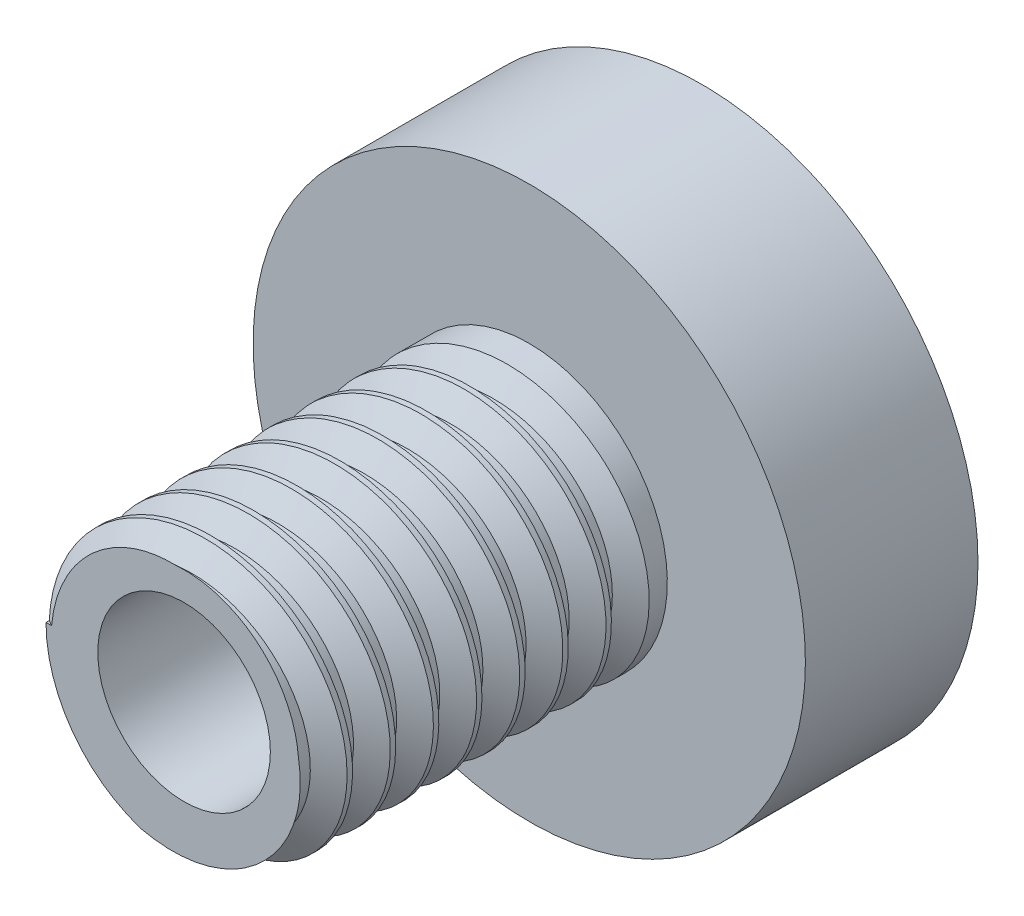
from build123d import *

# Parameters (mm, degrees)
THREAD_1_PITCH = 1.25


with BuildPart() as part:
    # Sketch 1 → Повернуть1 (revolve)
    with BuildSketch(Plane(origin=(0, 0, 0), x_dir=(1, 0, 0), z_dir=(0, 1, 0)), mode=Mode.PRIVATE) as revolve_1_sk:
        Polygon((-4, 0), (-4, 10), (-8, 10), (-8, 15), (-2.5, 15), (-2.5, 0), align=None)
    revolve(revolve_1_sk.sketch.rotate(Axis((0, 0, 0), (0, 0, -1)), 180), axis=Axis((0, 0, 0), (0, 0, -1)))

    # Резьба1: the profile of Sketch 1 2 profile screwed along a right-hand helix of 8 turns, 8 arcs to a turn; built about Z, then put on its axis
    thread_1_z = Axis((0, 0, 0), (0, 0, 1))
    thread_1_corners = [(4.0003, 0, -0.000173205), (4.0003, 0, 1.093923202), (3.323417656, 0, 0.703124998), (3.323417656, 0, 0.390624998)]
    with BuildLine(mode=Mode.PRIVATE) as thread_1_profile:
        Line(thread_1_corners[0], thread_1_corners[1])
        Line(thread_1_corners[1], thread_1_corners[2])
        Line(thread_1_corners[2], thread_1_corners[3])
        Line(thread_1_corners[3], thread_1_corners[0])
    thread_1_cap = Face(thread_1_profile.wire())
    thread_1_turn_angles = [0, 22.5, 45, 67.5, 90, 112.5, 135, 157.5, 180, 202.5, 225, 247.5, 270, 292.5, 315, 337.5, 360]
    thread_1_turn_weights = [1, 0.9238795325112867, 1, 0.9238795325112867, 1, 0.9238795325112867, 1, 0.9238795325112867, 1, 0.9238795325112867, 1, 0.9238795325112867, 1, 0.9238795325112867, 1, 0.9238795325112867, 1]
    thread_1_turn_rails = [Edge.make_bspline([Vector(p[0], p[1], 0).rotate(thread_1_z, thread_1_turn_angles[k]) / thread_1_turn_weights[k] + Vector(0, 0, p[2] + THREAD_1_PITCH * thread_1_turn_angles[k] / 360) for k in range(17)], [0, 0, 0, 1, 1, 2, 2, 3, 3, 4, 4, 5, 5, 6, 6, 7, 7, 8, 8, 8], 2, thread_1_turn_weights) for p in thread_1_corners]
    thread_1_turn_sides = [Face.make_surface_from_curves(thread_1_turn_rails[p[0]], thread_1_turn_rails[p[1]]) for p in [(0, 1), (1, 2), (2, 3), (3, 0)]]
    thread_1 = Plane(origin=(0, 0, 1), x_dir=(-1, 0, 0), z_dir=(0, 0, -1)) * Solid(Shell([*[p.moved(Location((0, 0, THREAD_1_PITCH * i))) for i in range(8) for p in thread_1_turn_sides], thread_1_cap, thread_1_cap.rotate(thread_1_z, 2880).moved(Location((0, 0, THREAD_1_PITCH * 2880 / 360)))]))
    add(thread_1, mode=Mode.SUBTRACT)


solid = part.part
